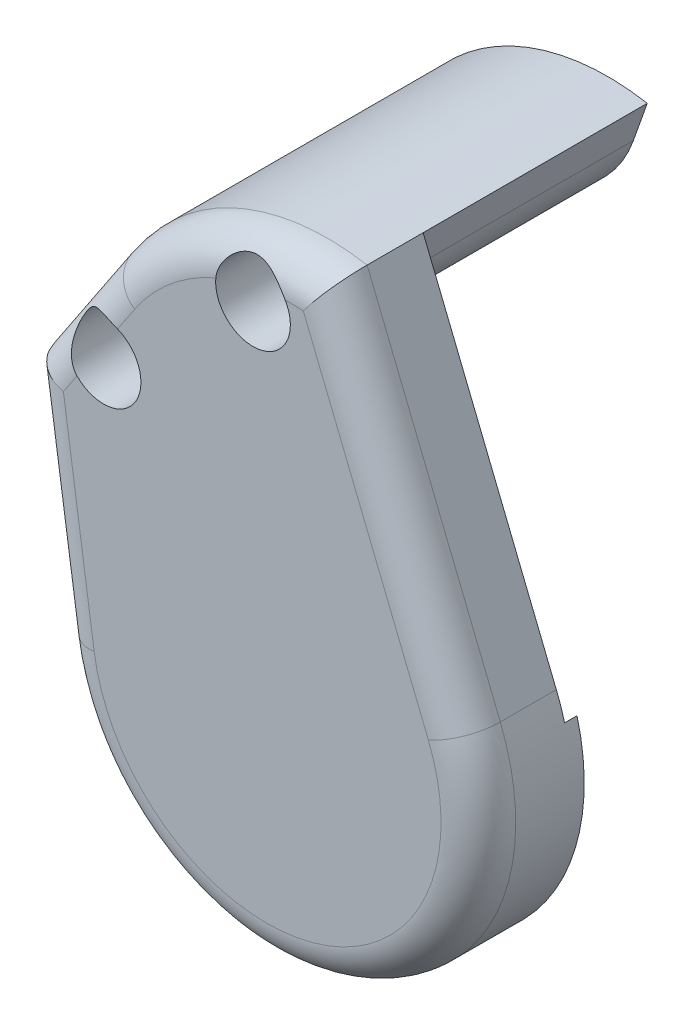
from build123d import *

# Parameters (mm, degrees)
SKETCH1_R                = 1.75
BOSS_EXTRUDE1_DEPTH      = 21
FILLET3_R                = 10
BOSS_EXTRUDE2_DEPTH      = 4.5
BOSS_EXTRUDE2_DEPTH_BACK = 4
SKETCH3_R                = 1.75
SKETCH4_R                = 11.25
CUT_EXTRUDE1_DEPTH       = 7
SKETCH5_R                = 13
CUT_EXTRUDE2_DEPTH       = 1.5
SKETCH6_R                = 3
CUT_EXTRUDE3_DEPTH       = 12
CUT_EXTRUDE4_DEPTH       = 1
FILLET7_R                = 3
FILLET8_R                = 10


with BuildPart() as part:
    # Sketch1 → Boss-Extrude1 (new body)
    with BuildSketch(Plane.XY):
        with BuildLine():
            Line((-8.845360825, 11.520618557), (-14.845360825, 2.520618557))
            Line((-14.845360825, 2.520618557), (-14.845360825, -0.479381443))
            Line((-14.845360825, -0.479381443), (-9.845360825, -0.479381443))
            Line((-9.845360825, -0.479381443), (-8.845360825, 0.520618557))
            ThreePointArc((-8.845360825, 0.520618557), (-1.696742799, 7.320595709), (6.83903909, 12.26861112))
            Line((6.83903909, 12.26861112), (9.318301605, 19.26861112))
            ThreePointArc((9.318301605, 19.26861112), (-0.918731235, 18.102760488), (-8.845360825, 11.520618557))
        make_face()
        with Locations(Location((-8.845360825, 5.020618557, 0), (0, 0, 180))):
            Circle(SKETCH1_R, mode=Mode.SUBTRACT)
        with Locations(Location((3.154639175, 15.020618557, 0), (0, 0, 180))):
            Circle(SKETCH1_R, mode=Mode.SUBTRACT)
    extrude(amount=BOSS_EXTRUDE1_DEPTH)

    # Fillet3
    # the kernel refuses this fillet: 10 mm, written as the material it takes off along each edge
    with BuildSketch(Plane(origin=(-9.845360825, -0.479381443, -10.932362995), x_dir=(-1, 0, 0), z_dir=(0, 0, 1))) as fillet3_piece_1:
        with BuildLine():
            CenterArc((4.372945198, -10), FILLET3_R, 90, 46.455884642)
            Line((-2.87549632, -3.110871204), (-3.600340471, -2.421958325))
            ThreePointArc((-3.600340471, -2.421958325), (-1.769425443, -0.361263367), (-0.707106781, 0.707106781))
            Line((-0.707106781, 0.707106781), (0, 1))
            Line((0, 1), (4.372945198, 1))
            Line((4.372945198, 1), (4.372945198, 0))
        make_face()
    extrude(amount=42.86472599, mode=Mode.SUBTRACT)

    # Sketch3 → Boss-Extrude2 (add, two sides: drawn at the far end of the back side and taken through both)
    with BuildSketch(Plane.XY.offset(21).offset(-BOSS_EXTRUDE2_DEPTH_BACK)):
        with BuildLine():
            Line((-14.845360825, 2.520618557), (-14.845360825, -0.479381443))
            Line((-14.845360825, -0.479381443), (-12.565000182, -16.009144975))
            ThreePointArc((-12.565000182, -16.009144975), (8.709502938, -29.945300767), (20.013420995, -7.162799635))
            Line((20.013420995, -7.162799635), (9.318301605, 19.26861112))
            ThreePointArc((9.318301605, 19.26861112), (-0.918731235, 18.102760488), (-8.845360825, 11.520618557))
            Line((-8.845360825, 11.520618557), (-14.845360825, 2.520618557))
        make_face()
        with Locations(Location((3.154639175, 15.020618557, 0), (0, 0, 180))):
            Circle(SKETCH3_R, mode=Mode.SUBTRACT)
        with Locations(Location((-8.845360825, 5.020618557, 0), (0, 0, 180))):
            Circle(SKETCH3_R, mode=Mode.SUBTRACT)
    extrude(amount=BOSS_EXTRUDE2_DEPTH + BOSS_EXTRUDE2_DEPTH_BACK)

    # Sketch4 → Cut-Extrude1 (cut)
    with BuildSketch(Plane(origin=(0, 0, 17), x_dir=(-1, 0, 0), z_dir=(0, 0, -1))):
        with Locations((-4.254639175, -13.539381443)):
            Circle(SKETCH4_R)
    extrude(amount=-CUT_EXTRUDE1_DEPTH, mode=Mode.SUBTRACT)

    # Sketch5 → Cut-Extrude2 (cut)
    with BuildSketch(Plane(origin=(0, 0, 17), x_dir=(-1, 0, 0), z_dir=(0, 0, -1))):
        with Locations((-4.254639175, -13.539381443)):
            Circle(SKETCH5_R)
    extrude(amount=-CUT_EXTRUDE2_DEPTH, mode=Mode.SUBTRACT)

    # Sketch6 → Cut-Extrude3 (cut)
    with BuildSketch(Plane.XY.offset(25.5)):
        with Locations((-8.845360825, 5.020618557)):
            Circle(SKETCH6_R)
        with Locations((3.154639175, 15.020618557)):
            Circle(SKETCH6_R)
    extrude(amount=-CUT_EXTRUDE3_DEPTH, mode=Mode.SUBTRACT)

    # Sketch7 → Cut-Extrude4 (cut)
    with BuildSketch(Plane(origin=(0, 0, 17), x_dir=(-1, 0, 0), z_dir=(0, 0, -1))):
        with BuildLine():
            Line((-19.320512006, -15.73138888), (-26.521187379, 19.26861112))
            Line((-26.521187379, 19.26861112), (-9.318301605, 19.26861112))
            Line((-9.318301605, 19.26861112), (-6.83903909, 12.26861112))
            ThreePointArc((-6.83903909, 12.26861112), (0.552528201, 8.148031782), (6.969864505, 2.631489761))
            Line((6.969864505, 2.631489761), (-2.943055137, 1.26861112))
            ThreePointArc((-2.943055137, 1.26861112), (-15.267616881, -3.247010549), (-19.320512006, -15.73138888))
        make_face()
    extrude(amount=-CUT_EXTRUDE4_DEPTH, mode=Mode.SUBTRACT)

    # Fillet7
    # the kernel refuses this fillet: 3 mm, written as the material it takes off along each edge
    with BuildSketch(Plane(origin=(-8.845360825, 11.520618557, 25.5), x_dir=(0, 0, -1), z_dir=(-0.554700196225229, -0.8320502943378438, 0))) as fillet7_piece_1:
        with BuildLine():
            CenterArc((FILLET7_R, FILLET7_R), FILLET7_R, 180, 90)
            Line((0, FILLET7_R), (0, 0))
            Line((0, 0), (FILLET7_R, 0))
        make_face()
    extrude(amount=18.316653826, mode=Mode.SUBTRACT)
    with BuildSketch(Plane(origin=(-18.114165499, 21.781905941, 25.5), x_dir=(0, 0, -1), z_dir=(0.14528020772302286, -0.9893905504116943, 0))) as fillet7_piece_2:
        with BuildLine():
            CenterArc((FILLET7_R, FILLET7_R), FILLET7_R, 180, 90)
            Line((0, FILLET7_R), (0, 0))
            Line((0, 0), (FILLET7_R, 0))
        make_face()
    extrude(amount=38.196292556, mode=Mode.SUBTRACT)
    with BuildSketch(Plane(origin=(4.254639175, -13.539381443, 25.5), x_dir=(-0.9893905504116943, -0.14528020772302197, 0), z_dir=(-0.14528020772302197, 0.9893905504116943, 0))) as fillet7_piece_3:
        with BuildLine():
            CenterArc((17 - FILLET7_R, -FILLET7_R), FILLET7_R, 0, 90)
            Line((17 - FILLET7_R, 0), (17, 0))
            Line((17, 0), (17, -FILLET7_R))
        make_face()
    revolve(axis=Axis((4.254639175, -13.539381443, 25.5), (0, 0, 1)), revolution_arc=193.67655813, mode=Mode.SUBTRACT)
    with BuildSketch(Plane(origin=(6.154639175, 1.520618557, 25.5), x_dir=(0.5584515746383966, 0.8295371232102247, 0), z_dir=(0.8295371232102247, -0.5584515746383966, 0))) as fillet7_piece_4:
        with BuildLine():
            CenterArc((18.027756377 - FILLET7_R, -FILLET7_R), FILLET7_R, 0, 90)
            Line((18.027756377 - FILLET7_R, 0), (18.027756377, 0))
            Line((18.027756377, 0), (18.027756377, -FILLET7_R))
        make_face()
    revolve(axis=Axis((6.154639175, 1.520618557, 25.5), (0, 0, 1)), revolution_arc=90.258713785, mode=Mode.SUBTRACT)
    with BuildSketch(Plane(origin=(20.013420995, -7.162799635, 25.5), x_dir=(-0.9269871658598542, -0.3750930475643543, 0), z_dir=(-0.37509304756435435, 0.9269871658598543, 0))) as fillet7_piece_5:
        with BuildLine():
            CenterArc((FILLET7_R, -FILLET7_R), FILLET7_R, 90, 90)
            Line((0, -FILLET7_R), (0, 0))
            Line((0, 0), (FILLET7_R, 0))
        make_face()
    extrude(amount=36.013243471, mode=Mode.SUBTRACT)

    # Fillet8
    fillet8_edges = [part.edges().sort_by_distance(p)[0] for p in [
        (6.83903909, 12.26861112, 9),
    ]]
    fillet(fillet8_edges, radius=FILLET8_R)


solid = part.part
